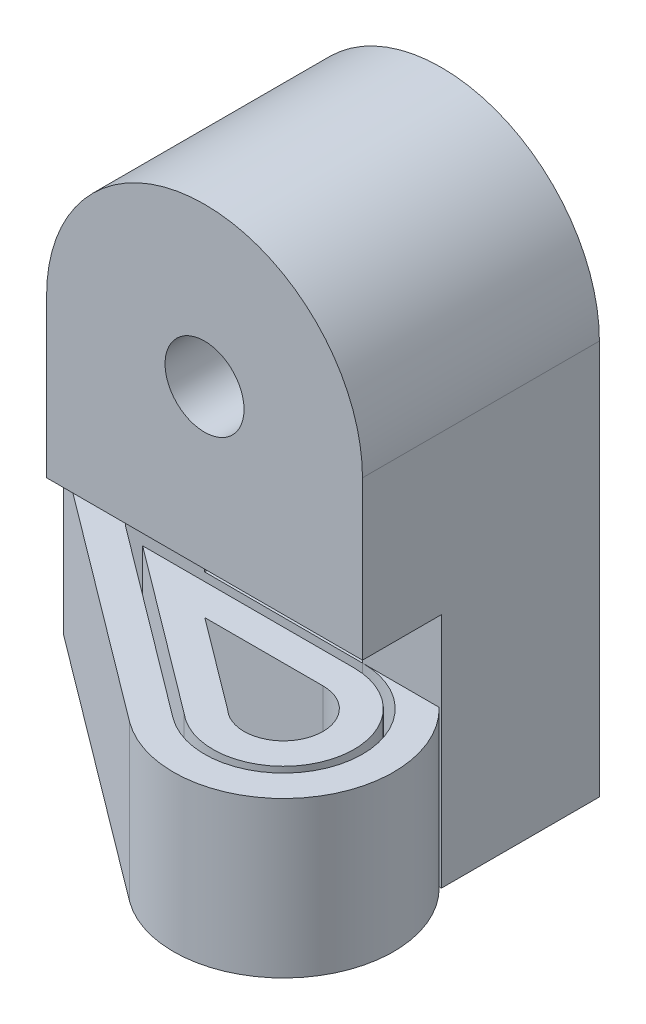
from build123d import *

# Parameters (mm, degrees)
BOSS_EXTRUDE2_DEPTH      = 50.8
BOSS_EXTRUDE3_DEPTH      = 25.4
SKETCH4_R                = 12.7
CUT_EXTRUDE2_DEPTH       = 219.499061783
EXTRUDE_THIN14_START     = -50
EXTRUDE_THIN14_OUTLINE_W = 50.8
EXTRUDE_THIN14_OUTLINE_H = 10
EXTRUDE_THIN14_DEPTH     = 50


# Read off the part's stored shape, not the designer's step: Extrude-Thin14
with BuildPart() as part:
    # Sketch1 → Boss-Extrude2 (new body)
    with BuildSketch(Plane.XY):
        with BuildLine():
            Line((0, 127), (0, 0))
            Line((0, 0), (25.4, 0))
            Line((25.4, 0), (25.4, 50.8))
            Line((25.4, 50.8), (76.2, 50.8))
            Line((76.2, 50.8), (76.2, 0))
            Line((76.2, 0), (101.6, 0))
            Line((101.6, 0), (101.6, 127))
            ThreePointArc((101.6, 127), (50.8, 177.8), (0, 127))
        make_face()
    extrude(amount=BOSS_EXTRUDE2_DEPTH)

    # Sketch3 → Boss-Extrude3 (add)
    with BuildSketch(Plane.XY.offset(50.8)):
        with BuildLine():
            Line((0, 127), (0, 76.2))
            Line((0, 76.2), (101.6, 76.2))
            Line((101.6, 76.2), (101.6, 127))
            ThreePointArc((101.6, 127), (50.8, 177.8), (0, 127))
        make_face()
    extrude(amount=BOSS_EXTRUDE3_DEPTH)

    # Sketch4 → Cut-Extrude2 (cut, through all)
    with BuildSketch(Plane.XY.offset(76.2)):
        with Locations((50.8, 127)):
            Circle(SKETCH4_R)
    extrude(amount=-CUT_EXTRUDE2_DEPTH, mode=Mode.SUBTRACT)

    # Extrude-Thin14 outline → Extrude-Thin14 (add)
    # profile 1 of 3: a face of its own
    with BuildSketch(Plane.XZ.offset(EXTRUDE_THIN14_START)):
        with BuildLine():
            Line((8.195486321, 53.5), (76.2, 53.5))
            ThreePointArc((76.2, 53.5), (97.466516312, 84.138846513), (61.324968382, 93.347111546))
            Line((61.324968382, 93.347111546), (8.195486321, 53.5))
        make_face()
        with BuildLine():
            ThreePointArc((67.650406883, 85.591190422), (88.043946098, 80.783769281), (76.2, 63.5))
            Line((76.2, 63.5), (38.195486321, 63.5))
            Line((38.195486321, 63.5), (67.650406883, 85.591190422))
        make_face(mode=Mode.SUBTRACT)
    # profile 2 of 3: a face of its own
    with BuildSketch(Plane.XZ.offset(EXTRUDE_THIN14_START)):
        with BuildLine():
            Line((76.2, 50.8), (100.857656012, 50.8))
            ThreePointArc((100.857656012, 50.8), (103.114302762, 99.195223566), (54.96, 104.52))
            Line((54.96, 104.52), (-30, 40.8))
            Line((-30, 40.8), (0, 40.8))
            Line((0, 40.8), (0, 50.8))
            Line((0, 50.8), (60.96, 96.52))
            ThreePointArc((60.96, 96.52), (100.29655577, 84.232185257), (76.2, 50.8))
        make_face()
    # profile 3 of 3: a face of its own
    with BuildSketch(Plane.XZ.offset(EXTRUDE_THIN14_START)):
        with Locations((50.8, 45.8)):
            Rectangle(EXTRUDE_THIN14_OUTLINE_W, EXTRUDE_THIN14_OUTLINE_H)
    extrude(amount=EXTRUDE_THIN14_DEPTH)


solid = part.part
